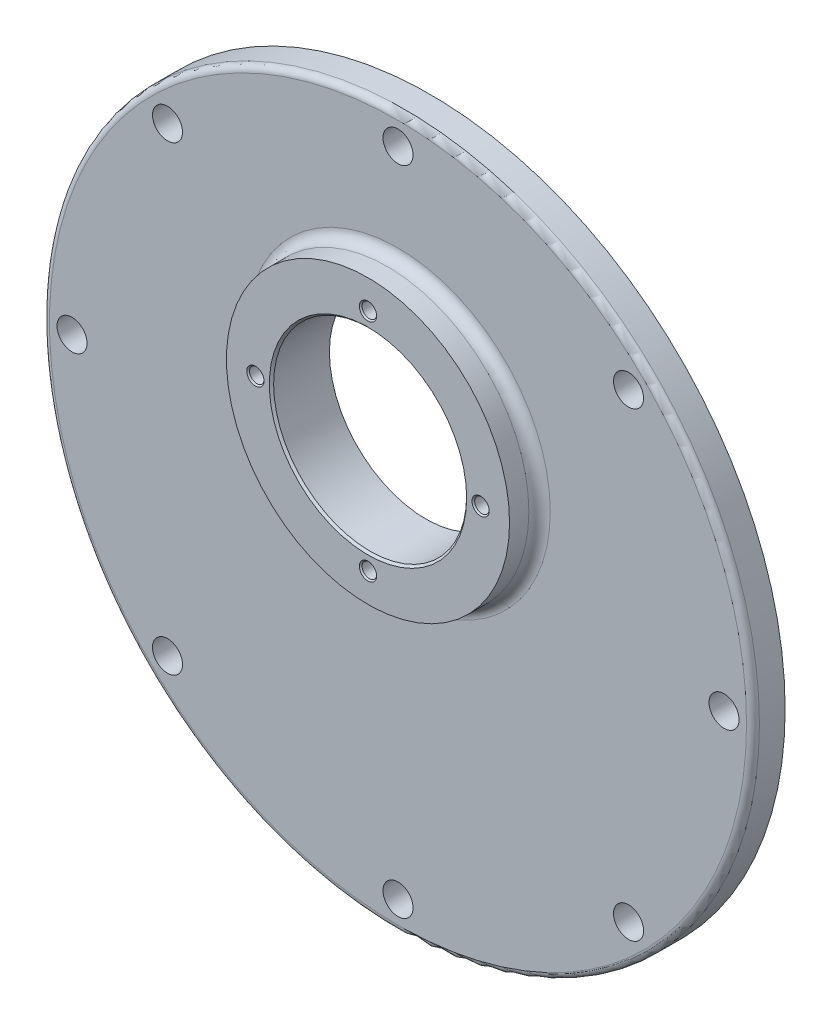
from build123d import *

# Parameters (mm, degrees)
SKETCH_1_R                   = 140
EXTRUDE_1_DEPTH              = 6
SKETCH_3_R                   = 165.5
EXTRUDE_2_DEPTH              = 15
SKETCH_4_R                   = 66
EXTRUDE_3_DEPTH              = 14
FILLET_1_R                   = 5
SKETCH_5_R                   = 133
CUT_EXTRUDE_1_DEPTH          = 11
SKETCH_6_R                   = 55
EXTRUDE_4_DEPTH              = 3
FILLET_2_R                   = 3
SKETCH_7_R                   = 45
CUT_EXTRUDE_2_DEPTH          = 236.604541552
CHAMFER_1_SIZE               = 1
HOLE_WIZARD_M8_1_D           = 6.8
HOLE_WIZARD_M8_1_DEPTH       = 13.957073895
HOLE_WIZARD_M8_1_CSINK_D     = 8.05
HOLE_WIZARD_M8_1_CSINK_ANGLE = 90
HOLE_WIZARD_M8_1_TIP         = 2.042926105
FILLET_3_R                   = 3
HOLE_WIZARD_1_D              = 8.8
HOLE_WIZARD_1_CBORE_D        = 14
HOLE_WIZARD_1_CBORE_DEPTH    = 10


with BuildPart() as part:
    # 草图1 → 凸台-拉伸1 (new body)
    with BuildSketch(Plane.XY):
        Circle(SKETCH_1_R)
    extrude(amount=EXTRUDE_1_DEPTH)

    # 草图3 → 凸台-拉伸2 (add)
    with BuildSketch(Plane.XY.offset(6)):
        Circle(SKETCH_3_R)
    extrude(amount=EXTRUDE_2_DEPTH)

    # 草图4 → 凸台-拉伸3 (add)
    with BuildSketch(Plane.XY.offset(21)):
        with Locations((0, 40)):
            Circle(SKETCH_4_R)
    extrude(amount=EXTRUDE_3_DEPTH)

    # 圆角1
    fillet_1_edges = [part.edges().sort_by_distance(p)[0] for p in [
        (-66, 40, 21),
    ]]
    fillet(fillet_1_edges, radius=FILLET_1_R)

    # 草图5 → 切除-拉伸1 (cut)
    with BuildSketch(Plane(origin=(0, 0, 0), x_dir=(-1, 0, 0), z_dir=(0, 0, -1))):
        Circle(SKETCH_5_R)
    extrude(amount=-CUT_EXTRUDE_1_DEPTH, mode=Mode.SUBTRACT)

    # 草图6 → 凸台-拉伸4 (add)
    with BuildSketch(Plane(origin=(0, 0, 11), x_dir=(-1, 0, 0), z_dir=(0, 0, -1))):
        with Locations((0, 40)):
            Circle(SKETCH_6_R)
    extrude(amount=EXTRUDE_4_DEPTH)

    # 圆角2
    fillet_2_edges = [part.edges().sort_by_distance(p)[0] for p in [
        (133, 0, 11),
        (55, 40, 11),
    ]]
    fillet(fillet_2_edges, radius=FILLET_2_R - 0.0001)  # a hair under: the kernel refuses the full size

    # 草图7 → 切除-拉伸2 (cut, through all)
    with BuildSketch(Plane(origin=(0, 0, 8), x_dir=(-1, 0, 0), z_dir=(0, 0, -1))):
        with Locations((0, 40)):
            Circle(SKETCH_7_R)
    extrude(amount=-CUT_EXTRUDE_2_DEPTH, mode=Mode.SUBTRACT)

    # 倒角1
    chamfer_1_edges = [part.edges().sort_by_distance(p)[0] for p in [
        (45, 40, 35),
    ]]
    chamfer(chamfer_1_edges, length=CHAMFER_1_SIZE)

    # M8 螺纹孔1
    with Locations(Plane.XY.offset(35)):
        with Locations((0, -12.5), (52.5, 40), (0, 92.5), (-52.5, 40)):
            CounterSinkHole(HOLE_WIZARD_M8_1_D / 2, HOLE_WIZARD_M8_1_CSINK_D / 2, depth=HOLE_WIZARD_M8_1_DEPTH, counter_sink_angle=HOLE_WIZARD_M8_1_CSINK_ANGLE)
            with Locations((0, 0, -(HOLE_WIZARD_M8_1_DEPTH + HOLE_WIZARD_M8_1_TIP / 2))):  # 118° drill point
                Cone(0, HOLE_WIZARD_M8_1_D / 2, HOLE_WIZARD_M8_1_TIP, mode=Mode.SUBTRACT)

    # 圆角3
    fillet_3_edges = [part.edges().sort_by_distance(p)[0] for p in [
        (-165.5, 0, 21),
    ]]
    fillet(fillet_3_edges, radius=FILLET_3_R)

    # 孔1 (through all)
    with Locations(Plane.XY.offset(21)):
        with Locations((107.48023074, 107.48023074), (152, 0), (107.48023074, -107.48023074), (0, -152), (-107.48023074, -107.48023074), (-152, 0), (-107.48023074, 107.48023074), (0, 152)):
            CounterBoreHole(HOLE_WIZARD_1_D / 2, HOLE_WIZARD_1_CBORE_D / 2, HOLE_WIZARD_1_CBORE_DEPTH)


solid = part.part
